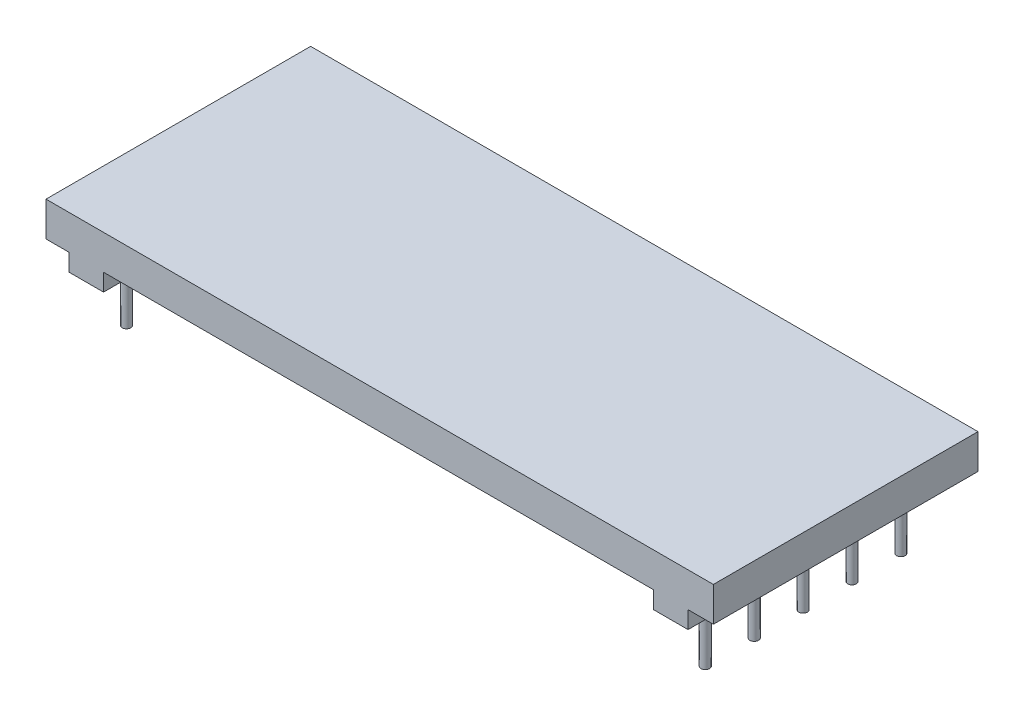
from build123d import *

# Parameters (mm, degrees)
SKETCH1_W           = 58
SKETCH1_H           = 23
BOSS_EXTRUDE1_DEPTH = 3
SKETCH2_W           = 3
SKETCH2_H           = 23
BOSS_EXTRUDE2_DEPTH = 1.5
SKETCH3_R           = 0.375
BOSS_EXTRUDE3_DEPTH = 5
LPATTERN1_COUNT     = 2
LPATTERN1_PITCH     = 50.8
SKETCH4_R           = 0.375
BOSS_EXTRUDE4_DEPTH = 5


with BuildPart() as part:
    # Sketch1 → Boss-Extrude1 (new body)
    with BuildSketch(Plane(origin=(0, 0, 0), x_dir=(1, 0, 0), z_dir=(0, 1, 0))):
        Rectangle(SKETCH1_W, SKETCH1_H)
    extrude(amount=BOSS_EXTRUDE1_DEPTH)

    # Sketch2 → Boss-Extrude2 (add)
    with BuildSketch(Plane.XZ):
        with Locations((-25.5, 0)):
            Rectangle(SKETCH2_W, SKETCH2_H)
    boss_extrude2 = extrude(amount=BOSS_EXTRUDE2_DEPTH)

    # Sketch3 → Boss-Extrude3 (add)
    with BuildSketch(Plane.XZ.offset(1.5)):
        with Locations((-25.5, 8)):
            Circle(SKETCH3_R)
        with Locations((-25.5, 0)):
            Circle(SKETCH3_R)
        with Locations((-25.5, -8)):
            Circle(SKETCH3_R)
    extrude(amount=BOSS_EXTRUDE3_DEPTH)

    # LPattern1: Boss-Extrude2 ×2
    with Locations(*[(i * LPATTERN1_PITCH, 0, 0) for i in range(1, LPATTERN1_COUNT)]):
        add(boss_extrude2)

    # Sketch4 → Boss-Extrude4 (add)
    with BuildSketch(Plane.XZ.offset(1.5)):
        with Locations((25.3, 8.5)):
            Circle(SKETCH4_R)
        with Locations((25.3, 4.25)):
            Circle(SKETCH4_R)
        with Locations((25.3, 0)):
            Circle(SKETCH4_R)
        with Locations((25.3, -4.25)):
            Circle(SKETCH4_R)
        with Locations((25.3, -8.5)):
            Circle(SKETCH4_R)
    extrude(amount=BOSS_EXTRUDE4_DEPTH)


solid = part.part
